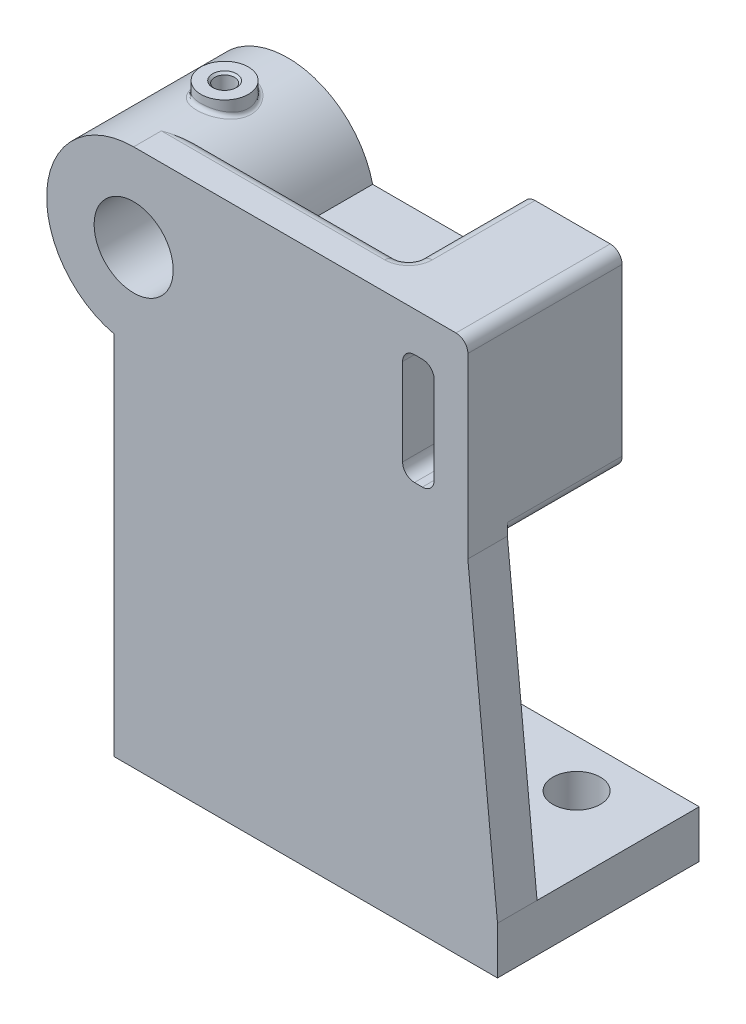
from build123d import *

# Parameters (mm, degrees)
SKETCH1_W                = 92
SKETCH1_H                = 12
BOSS_EXTRUDE1_DEPTH      = 51
SKETCH9_R                = 22
BOSS_EXTRUDE4_DEPTH      = 39
SKETCH9_W                = 25
SKETCH9_H                = 48
SKETCH9_W_2              = 8
SKETCH9_H_2              = 28
BOSS_EXTRUDE4_2_DEPTH    = 39
BOSS_EXTRUDE5_DEPTH      = 5
BOSS_EXTRUDE6_DEPTH      = 10
BOSS_EXTRUDE7_START      = -29
BOSS_EXTRUDE7_DEPTH      = 29
BOSS_EXTRUDE8_REACH      = 176.316
BOSS_EXTRUDE8_END_RADIUS = 22
SKETCH15_R               = 6
FILLET1_R                = 3
FILLET2_R                = 3
FILLET3_R                = 3
FILLET4_R                = 1
HOLE3_D                  = 12
HOLE3_DEPTH              = 12
LPATTERN1_COUNT          = 2
LPATTERN1_PITCH          = 44


# Read off the part's stored shape, not the designer's step: M6 Tapped Hole1
with BuildPart() as part:
    # Sketch1 → Boss-Extrude1 (new body)
    with BuildSketch(Plane.XY):
        with Locations((46, 6)):
            Rectangle(SKETCH1_W, SKETCH1_H)
    extrude(amount=BOSS_EXTRUDE1_DEPTH)



with BuildPart() as body_2:
    # Sketch9 → Boss-Extrude4 (new body)
    with BuildSketch(Plane.XY.offset(51)):
        with Locations((0, 114)):
            Circle(SKETCH9_R)
    extrude(amount=-BOSS_EXTRUDE4_DEPTH)


with BuildPart() as body_3:
    # Sketch9 → Boss-Extrude4 2 (new body)
    with BuildSketch(Plane.XY.offset(51)):
        with Locations((72, 112)):
            Rectangle(SKETCH9_W, SKETCH9_H)
        with Locations((72, 112)):
            Rectangle(SKETCH9_W_2, SKETCH9_H_2, mode=Mode.SUBTRACT)
    extrude(amount=-BOSS_EXTRUDE4_2_DEPTH)


with BuildPart() as part_1:
    add(part.part)

    add(body_2.part)  # Boss-Extrude5 merges body 2
    # Sketch10 → Boss-Extrude5 (add, symmetric)
    with BuildSketch(Plane.ZY):
        Polygon((0, 0), (0, 12), (12, 88), (12, 94), (51, 94), (51, 88), (51, 12), (51, 0), align=None)
    extrude(amount=BOSS_EXTRUDE5_DEPTH, both=True)

    # Sketch12 → Hole2 (revolve, cut)
    with BuildSketch(Plane(origin=(0, 114, 12), x_dir=(0, 1, 0), z_dir=(1, 0, 0))):
        Polygon((0, 0), (0, 39.001), (10, 39.001), (10, 5), (16, 5), (16, 0), align=None)
    revolve(axis=Axis((0, 114, 122), (0, 0, -1)), mode=Mode.SUBTRACT)


    add(body_3.part)  # Boss-Extrude6 merges body 3
    # Sketch13 → Boss-Extrude6 (add)
    with BuildSketch(Plane.XY.offset(51)):
        with BuildLine():
            Line((92, 12), (5, 12))
            Line((5, 12), (5, 92.575714714))
            ThreePointArc((5, 92.575714714), (21.85559741, 116.516517804), (0, 136))
            Line((0, 136), (59.5, 136))
            Line((59.5, 136), (59.5, 88))
            Line((59.5, 88), (84.5, 88))
            Line((84.5, 88), (92, 12))
        make_face()
    extrude(amount=-BOSS_EXTRUDE6_DEPTH)

    # Sketch14 → Boss-Extrude7 (add)
    with BuildSketch(Plane(origin=(0, 0, 12), x_dir=(-1, 0, 0), z_dir=(0, 0, -1)).offset(BOSS_EXTRUDE7_START)):
        with BuildLine():
            Line((-59.5, 119), (-59.5, 109))
            Line((-59.5, 109), (-21.424285286, 109))
            ThreePointArc((-21.424285286, 109), (-22, 114), (-21.424285286, 119))
            Line((-21.424285286, 119), (-59.5, 119))
        make_face()
    extrude(amount=BOSS_EXTRUDE7_DEPTH)

    # Boss-Extrude8: up to this cylinder (the profile starts outside it)
    boss_extrude8_end = Plane(origin=(0, 114, 28), z_dir=(0, 0, 1)) * Cylinder(BOSS_EXTRUDE8_END_RADIUS, 397.632, mode=Mode.PRIVATE)
    # Sketch15 → Boss-Extrude8 (add, up to the surface)
    with BuildSketch(Plane(origin=(0, 139, 0), x_dir=(1, 0, 0), z_dir=(0, 1, 0)), mode=Mode.PRIVATE) as boss_extrude8_sk1:
        with Locations(Location((0, -28, 0), (0, 0, 270))):
            Circle(SKETCH15_R)
    boss_extrude8_tool1 = extrude(boss_extrude8_sk1.sketch, amount=-BOSS_EXTRUDE8_REACH, mode=Mode.PRIVATE) - boss_extrude8_end
    add(boss_extrude8_tool1.solids().sort_by_distance((0, 139, 28))[0])

    # M6 Tapped Hole1 outline → M6 Tapped Hole1 (revolve, cut)
    with BuildSketch(Plane.XY.offset(28)):
        Polygon((0, 123.682411551), (2.5, 123.682411551), (2.5, 138.475), (3.025, 139), (0, 139), align=None)
    revolve(axis=Axis((0, 0, 28), (0, 1, 0)), mode=Mode.SUBTRACT)

    # Fillet1
    # the kernel refuses this fillet: 3 mm, written as the material it adds along each edge
    with BuildSketch(Plane(origin=(59.5, 136, 41), x_dir=(-1, 0, 0), z_dir=(0, -1, 0))) as fillet1_piece_1:
        with BuildLine():
            CenterArc((FILLET1_R, FILLET1_R), FILLET1_R, 180, 90)
            Line((0, FILLET1_R), (0, 0))
            Line((0, 0), (FILLET1_R, 0))
        make_face()
    extrude(amount=24.5)
    # the kernel refuses this fillet: 3 mm, written as the material it takes off along each edge
    with BuildSketch(Plane(origin=(59.5, 88, 41), x_dir=(0, 1, 0), z_dir=(0, 0, -1))) as fillet1_2_piece_1:
        with BuildLine():
            CenterArc((FILLET1_R, FILLET1_R), FILLET1_R, 180, 90)
            Line((0, FILLET1_R), (0, 0))
            Line((0, 0), (FILLET1_R, 0))
        make_face()
    extrude(amount=36.5, mode=Mode.SUBTRACT)
    # the kernel refuses this fillet: 3 mm, written as the material it takes off along each edge
    with BuildSketch(Plane(origin=(-7.5, 136, 41), x_dir=(0, 0, 1), z_dir=(1, 0, 0))) as fillet1_3_piece_1_section:
        with BuildLine():
            CenterArc((FILLET1_R, FILLET1_R), FILLET1_R, 180, 90)
            Line((0, FILLET1_R), (0, 0))
            Line((0, 0), (FILLET1_R, 0))
        make_face()
    fillet1_3_piece_1 = extrude(amount=64, mode=Mode.PRIVATE)
    fillet1_3_piece_1 = fillet1_3_piece_1 - Plane(origin=(0, 114, 41.685678885), x_dir=(1, 0, 0), z_dir=(0, 0, 1)) * Cylinder(22, 140, mode=Mode.PRIVATE)
    add(fillet1_3_piece_1, mode=Mode.SUBTRACT)
    with BuildSketch(Plane(origin=(59.5, 136, 38), x_dir=(1, 0, 0), z_dir=(0, 0, -1))) as fillet1_3_piece_2:
        with BuildLine():
            CenterArc((FILLET1_R, FILLET1_R), FILLET1_R, 180, 90)
            Line((0, FILLET1_R), (0, 0))
            Line((0, 0), (FILLET1_R, 0))
        make_face()
    extrude(amount=33.5, mode=Mode.SUBTRACT)
    with BuildSketch(Plane(origin=(56.5, 136, 38), x_dir=(0, 0, 1), z_dir=(-1, 0, 0))) as fillet1_3_piece_3:
        with BuildLine():
            CenterArc((3 + FILLET1_R, -FILLET1_R), FILLET1_R, 90, 90)
            Line((3, -FILLET1_R), (3, 0))
            Line((3, 0), (3 + FILLET1_R, 0))
        make_face()
    revolve(axis=Axis((56.5, 136, 38), (0, 1, 0)), revolution_arc=90, mode=Mode.SUBTRACT)

    # Fillet2
    fillet2_edges = [part_1.edges().sort_by_distance(p)[0] for p in [
        (68, 98, 31.5),
        (76, 98, 31.5),
        (76, 126, 31.5),
        (68, 126, 31.5),
    ]]
    fillet(fillet2_edges, radius=FILLET2_R)

    # Fillet3
    # the kernel refuses this fillet: 3 mm, written as the material it takes off along each edge
    with BuildSketch(Plane(origin=(84.5, 136, 58.5), x_dir=(-1, 0, 0), z_dir=(0, 0, -1))) as fillet3_piece_1:
        with BuildLine():
            CenterArc((FILLET3_R, -FILLET3_R), FILLET3_R, 90, 90)
            Line((0, -FILLET3_R), (0, 0))
            Line((0, 0), (FILLET3_R, 0))
        make_face()
    extrude(amount=54, mode=Mode.SUBTRACT)
    with BuildSketch(Plane(origin=(84.5, 88, 41), x_dir=(0, 1, 0), z_dir=(0, 0, -1))) as fillet3_piece_2:
        with BuildLine():
            CenterArc((FILLET3_R, -FILLET3_R), FILLET3_R, 90, 90)
            Line((0, -FILLET3_R), (0, 0))
            Line((0, 0), (FILLET3_R, 0))
        make_face()
    extrude(amount=36.5, mode=Mode.SUBTRACT)

    # Fillet4
    fillet4_edges = [part_1.edges().sort_by_distance(p)[0] for p in [
        (1e-09, 135.999999999, 21.999999993),
    ]]
    fillet(fillet4_edges, radius=FILLET4_R)

    # Hole3
    with Locations(Plane(origin=(0, 12, 0), x_dir=(1, 0, 0), z_dir=(0, 1, 0))):
        with Locations((73, -12)):
            hole3 = Hole(HOLE3_D / 2, depth=HOLE3_DEPTH)

    # LPattern1: Hole3 ×2
    with Locations(*[(-i * LPATTERN1_PITCH, 0, 0) for i in range(1, LPATTERN1_COUNT)]):
        add(hole3, mode=Mode.SUBTRACT)


solid = part_1.part
